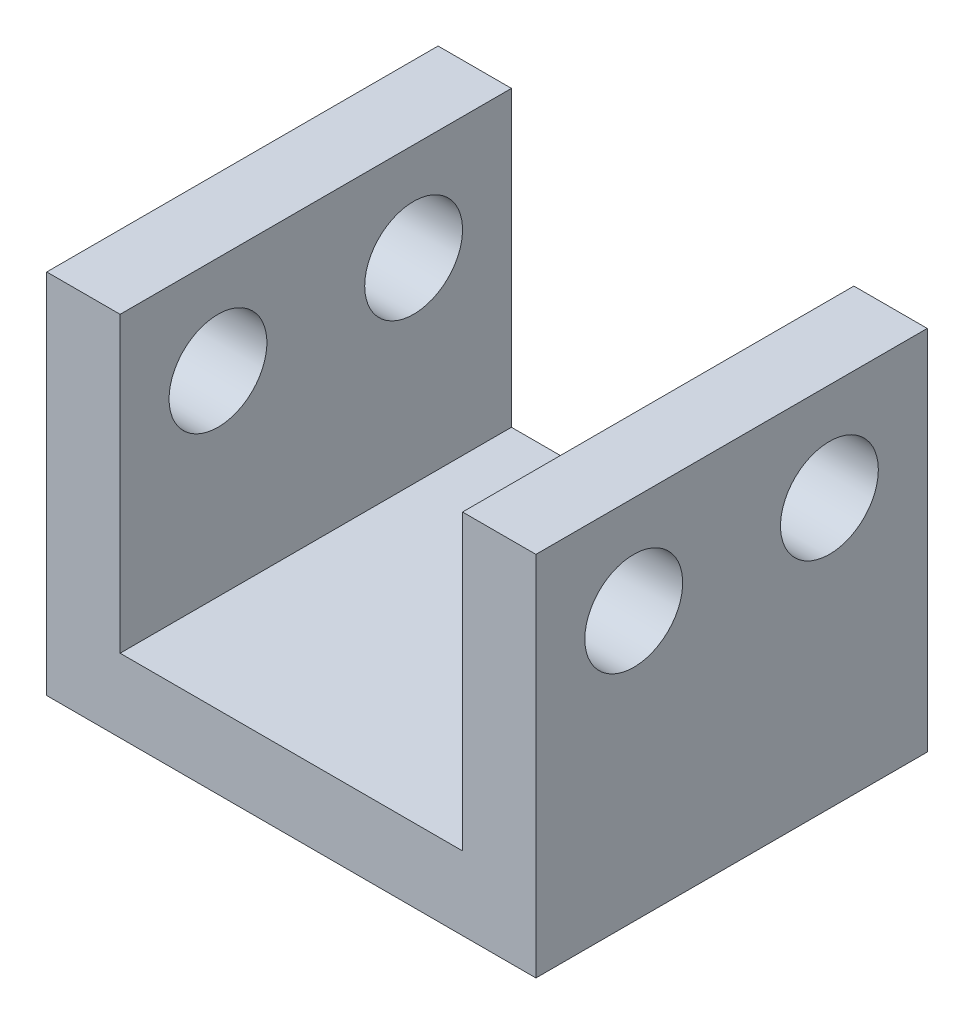
from build123d import *

# Parameters (mm, degrees)
SKETCH1_W           = 10
SKETCH1_H           = 8
BOSS_EXTRUDE1_DEPTH = 1.5
SKETCH3_W           = 1.5
SKETCH3_H           = 8
BOSS_EXTRUDE2_DEPTH = 6
SKETCH4_R           = 1.2
CUT_EXTRUDE1_DEPTH  = 9.774964387
SKETCH5_R           = 1
CUT_EXTRUDE2_DEPTH  = 14.124404748


with BuildPart() as part:
    # Sketch1 → Boss-Extrude1 (new body)
    with BuildSketch(Plane(origin=(0, 0, 0), x_dir=(1, 0, 0), z_dir=(0, 1, 0))):
        Rectangle(SKETCH1_W, SKETCH1_H)
    extrude(amount=BOSS_EXTRUDE1_DEPTH)

    # Sketch3 → Boss-Extrude2 (add)
    with BuildSketch(Plane(origin=(0, 1.5, 0), x_dir=(1, 0, 0), z_dir=(0, 1, 0))):
        with Locations((-4.25, 0)):
            Rectangle(SKETCH3_W, SKETCH3_H)
        with Locations((4.25, 0)):
            Rectangle(SKETCH3_W, SKETCH3_H)
    extrude(amount=BOSS_EXTRUDE2_DEPTH)

    # Sketch4 → Cut-Extrude1 (cut, through all)
    with BuildSketch(Plane(origin=(0, 1.5, 0), x_dir=(1, 0, 0), z_dir=(0, 1, 0))):
        with Locations((0, 1.734711092)):
            Circle(SKETCH4_R)
    extrude(amount=-CUT_EXTRUDE1_DEPTH, mode=Mode.SUBTRACT)

    # Sketch5 → Cut-Extrude2 (cut, through all)
    with BuildSketch(Plane.ZY.offset(5)):
        with Locations((2, 5.5)):
            Circle(SKETCH5_R)
    cut_extrude2 = extrude(amount=-CUT_EXTRUDE2_DEPTH, mode=Mode.SUBTRACT)

    # Mirror1: Cut-Extrude2 across plane
    add(cut_extrude2.mirror(Plane.XY), mode=Mode.SUBTRACT)


solid = part.part
